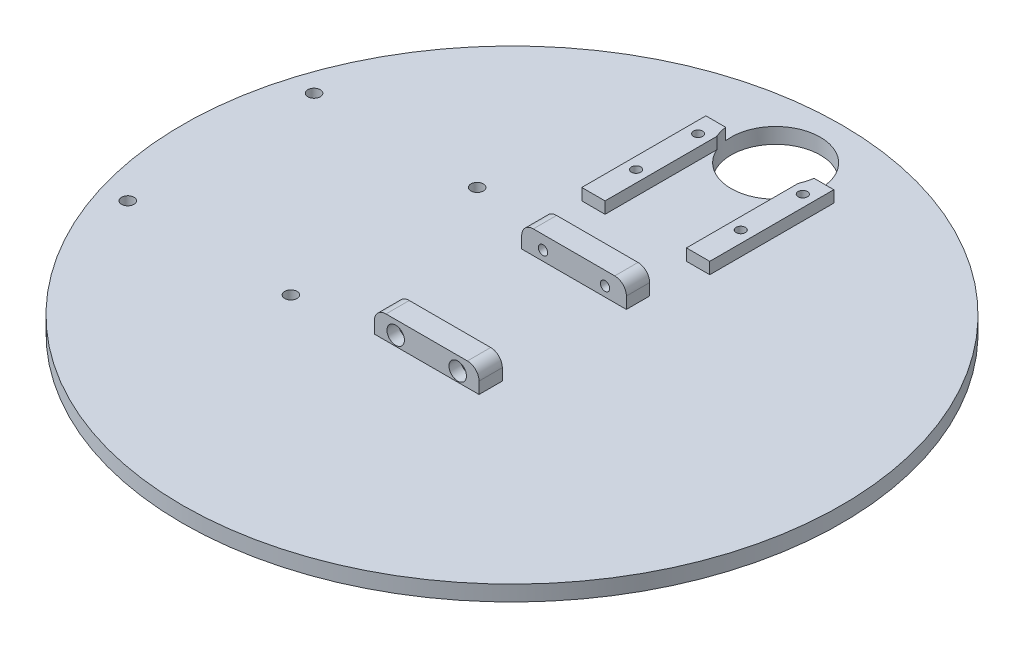
from build123d import *

# Parameters (mm, degrees)
SKETCH1_R                                           = 37.65
SKETCH1_R_2                                         = 32.65
BOSS_EXTRUDE1_DEPTH                                 = 10
BOSS_EXTRUDE2_START                                 = -4
SKETCH2_R                                           = 32.65
SKETCH2_R_2                                         = 29.65
BOSS_EXTRUDE2_DEPTH                                 = 4
SKETCH3_R                                           = 85
BOSS_EXTRUDE3_DEPTH                                 = 4
SKETCH4_W                                           = 27
SKETCH4_H                                           = 6
BOSS_EXTRUDE4_DEPTH                                 = 6
FILLET1_R                                           = 3
SKETCH6_R                                           = 2.25
CUT_EXTRUDE1_DEPTH                                  = 3
CSK_FOR_M2_COUNTERSUNK_FLAT_HEAD_SCREW1_D           = 2.4
CSK_FOR_M2_COUNTERSUNK_FLAT_HEAD_SCREW1_CSINK_D     = 4.4
CSK_FOR_M2_COUNTERSUNK_FLAT_HEAD_SCREW1_CSINK_ANGLE = 90
FILLET1_OF_MIRROR1_R                                = 3
SKETCH8_R                                           = 2.25
CUT_EXTRUDE2_DEPTH                                  = 4
SKETCH11_W                                          = 6
SKETCH11_H                                          = 16
BOSS_EXTRUDE5_DEPTH                                 = 3
CSK_FOR_M2_COUNTERSUNK_FLAT_HEAD_SCREW2_D           = 2.4
CSK_FOR_M2_COUNTERSUNK_FLAT_HEAD_SCREW2_CSINK_D     = 4.4
CSK_FOR_M2_COUNTERSUNK_FLAT_HEAD_SCREW2_CSINK_ANGLE = 90
LPATTERN1_COPY_1_SKETCH_R                           = 2.25
LPATTERN1_COPY_1_DEPTH                              = 4
LPATTERN1_COPY_2_SKETCH_W                           = 6
LPATTERN1_COPY_2_SKETCH_H                           = 16
LPATTERN1_COPY_2_DEPTH                              = 3
LPATTERN1_COPY_3_D                                  = 2.4
LPATTERN1_COPY_3_CSINK_D                            = 4.4
LPATTERN1_COPY_3_CSINK_ANGLE                        = 90
LPATTERN1_COPY_4_SKETCH_R                           = 2.25
LPATTERN1_COPY_4_DEPTH                              = 4
LPATTERN1_COPY_5_SKETCH_W                           = 6
LPATTERN1_COPY_5_SKETCH_H                           = 16
LPATTERN1_COPY_5_DEPTH                              = 3
LPATTERN1_COPY_6_D                                  = 2.4
LPATTERN1_COPY_6_CSINK_D                            = 4.4
LPATTERN1_COPY_6_CSINK_ANGLE                        = 90
CUT_EXTRUDE3_DEPTH                                  = 122.020659393
CUT_EXTRUDE3_DEPTH_BACK                             = 122.020659393
SKETCH12_R                                          = 11.5
CSK_FOR_M3_COUNTERSUNK_FLAT_HEAD_SCREW1_D           = 3.2
CSK_FOR_M3_COUNTERSUNK_FLAT_HEAD_SCREW1_CSINK_D     = 6.3
CSK_FOR_M3_COUNTERSUNK_FLAT_HEAD_SCREW1_CSINK_ANGLE = 90


with BuildPart() as part:
    # Sketch1 → Boss-Extrude1 (new body)
    with BuildSketch(Plane(origin=(0, 0, 0), x_dir=(1, 0, 0), z_dir=(0, 1, 0))):
        Circle(SKETCH1_R)
        Circle(SKETCH1_R_2, mode=Mode.SUBTRACT)
    extrude(amount=BOSS_EXTRUDE1_DEPTH)

    # Sketch2 → Boss-Extrude2 (add)
    with BuildSketch(Plane(origin=(0, 10, 0), x_dir=(1, 0, 0), z_dir=(0, 1, 0)).offset(BOSS_EXTRUDE2_START)):
        Circle(SKETCH2_R)
        Circle(SKETCH2_R_2, mode=Mode.SUBTRACT)
    extrude(amount=BOSS_EXTRUDE2_DEPTH)

    # Sketch3 → Boss-Extrude3 (add)
    with BuildSketch(Plane(origin=(0, 10, 0), x_dir=(1, 0, 0), z_dir=(0, 1, 0))):
        Circle(SKETCH3_R)
    extrude(amount=BOSS_EXTRUDE3_DEPTH)

    # Sketch4 → Boss-Extrude4 (add)
    with BuildSketch(Plane(origin=(0, 14, 0), x_dir=(1, 0, 0), z_dir=(0, 1, 0))):
        with Locations((0, 19)):
            Rectangle(SKETCH4_W, SKETCH4_H)
    boss_extrude4 = extrude(amount=BOSS_EXTRUDE4_DEPTH)

    # Fillet1
    fillet1_edges = [part.edges().sort_by_distance(p)[0] for p in [
        (-13.5, 20, -19),
        (13.5, 20, -19),
    ]]
    fillet(fillet1_edges, radius=FILLET1_R)

    # Sketch6 → Cut-Extrude1 (cut)
    with BuildSketch(Plane(origin=(0, 0, -22), x_dir=(-1, 0, 0), z_dir=(0, 0, -1))):
        with Locations((-8, 16.5)):
            Circle(SKETCH6_R)
        with Locations((8, 16.5)):
            Circle(SKETCH6_R)
    cut_extrude1 = extrude(amount=-CUT_EXTRUDE1_DEPTH, mode=Mode.SUBTRACT)

    # CSK for M2 Countersunk Flat Head Screw1 (through all)
    with Locations(Plane(origin=(8, 16.5, -19), x_dir=(-1, 0, 0), z_dir=(0, 0, -1))):
        with Locations((0, 0), (16, 0)):
            csk_for_m2_countersunk_flat_head_screw1 = CounterSinkHole(CSK_FOR_M2_COUNTERSUNK_FLAT_HEAD_SCREW1_D / 2, CSK_FOR_M2_COUNTERSUNK_FLAT_HEAD_SCREW1_CSINK_D / 2, counter_sink_angle=CSK_FOR_M2_COUNTERSUNK_FLAT_HEAD_SCREW1_CSINK_ANGLE)

    # Mirror1: Boss-Extrude4, Cut-Extrude1, CSK for M2 Countersunk Flat Head Screw1 across plane
    add(boss_extrude4.mirror(Plane.XY))
    add(cut_extrude1.mirror(Plane.XY), mode=Mode.SUBTRACT)
    add(csk_for_m2_countersunk_flat_head_screw1.mirror(Plane.XY), mode=Mode.SUBTRACT)

    # Fillet1 of Mirror1
    fillet1_of_mirror1_edges = [part.edges().sort_by_distance(p)[0] for p in [
        (-13.5, 20, 19),
        (13.5, 20, 19),
    ]]
    fillet(fillet1_of_mirror1_edges, radius=FILLET1_OF_MIRROR1_R)

    # Sketch8 → Cut-Extrude2 (cut)
    with BuildSketch(Plane(origin=(0, 10, 0), x_dir=(-1, 0, 0), z_dir=(0, -1, 0))):
        with Locations((13.5, 61.5)):
            Circle(SKETCH8_R)
    cut_extrude2 = extrude(amount=-CUT_EXTRUDE2_DEPTH, mode=Mode.SUBTRACT)

    # Sketch11 → Boss-Extrude5 (add)
    with BuildSketch(Plane(origin=(0, 14, 0), x_dir=(1, 0, 0), z_dir=(0, 1, 0))):
        with Locations((-13.5, 58.5)):
            Rectangle(SKETCH11_W, SKETCH11_H)
    boss_extrude5 = extrude(amount=BOSS_EXTRUDE5_DEPTH)

    # CSK for M2 Countersunk Flat Head Screw2 (through all)
    with Locations(Plane(origin=(-13.5, 14, -61.5), x_dir=(0, 0, -1), z_dir=(0, -1, 0))):
        with Locations((0, 0)):
            csk_for_m2_countersunk_flat_head_screw2 = CounterSinkHole(CSK_FOR_M2_COUNTERSUNK_FLAT_HEAD_SCREW2_D / 2, CSK_FOR_M2_COUNTERSUNK_FLAT_HEAD_SCREW2_CSINK_D / 2, counter_sink_angle=CSK_FOR_M2_COUNTERSUNK_FLAT_HEAD_SCREW2_CSINK_ANGLE)

    # Mirror2: Cut-Extrude2, Boss-Extrude5, CSK for M2 Countersunk Flat Head Screw2 across plane
    add(cut_extrude2.mirror(Plane(origin=(0, 0, 0), x_dir=(0, 0, 1), z_dir=(1, 0, 0))), mode=Mode.SUBTRACT)
    add(boss_extrude5.mirror(Plane(origin=(0, 0, 0), x_dir=(0, 0, 1), z_dir=(1, 0, 0))))
    add(csk_for_m2_countersunk_flat_head_screw2.mirror(Plane(origin=(0, 0, 0), x_dir=(0, 0, 1), z_dir=(1, 0, 0))), mode=Mode.SUBTRACT)

    # LPattern1 copy 1 sketch → LPattern1 copy 1 (cut)
    with BuildSketch(Plane(origin=(0, 10, 16), x_dir=(1, 0, 0), z_dir=(0, -1, 0))):
        with Locations((13.5, -61.5)):
            Circle(LPATTERN1_COPY_1_SKETCH_R)
    extrude(amount=-LPATTERN1_COPY_1_DEPTH, mode=Mode.SUBTRACT)

    # LPattern1 copy 2 sketch → LPattern1 copy 2 (add)
    with BuildSketch(Plane(origin=(0, 14, 16), x_dir=(-1, 0, 0), z_dir=(0, 1, 0))):
        with Locations((-13.5, -58.5)):
            Rectangle(LPATTERN1_COPY_2_SKETCH_W, LPATTERN1_COPY_2_SKETCH_H)
    extrude(amount=LPATTERN1_COPY_2_DEPTH)

    # LPattern1 copy 3 (through all)
    with Locations(Plane(origin=(13.5, 14, -45.5), x_dir=(0, 0, -1), z_dir=(0, -1, 0))):
        with Locations((0, 0)):
            CounterSinkHole(LPATTERN1_COPY_3_D / 2, LPATTERN1_COPY_3_CSINK_D / 2, counter_sink_angle=LPATTERN1_COPY_3_CSINK_ANGLE)

    # LPattern1 copy 4 sketch → LPattern1 copy 4 (cut)
    with BuildSketch(Plane(origin=(0, 10, 16), x_dir=(-1, 0, 0), z_dir=(0, -1, 0))):
        with Locations((13.5, 61.5)):
            Circle(LPATTERN1_COPY_4_SKETCH_R)
    extrude(amount=-LPATTERN1_COPY_4_DEPTH, mode=Mode.SUBTRACT)

    # LPattern1 copy 5 sketch → LPattern1 copy 5 (add)
    with BuildSketch(Plane(origin=(0, 14, 16), x_dir=(1, 0, 0), z_dir=(0, 1, 0))):
        with Locations((-13.5, 58.5)):
            Rectangle(LPATTERN1_COPY_5_SKETCH_W, LPATTERN1_COPY_5_SKETCH_H)
    extrude(amount=LPATTERN1_COPY_5_DEPTH)

    # LPattern1 copy 6 (through all)
    with Locations(Plane(origin=(-13.5, 14, -45.5), x_dir=(0, 0, -1), z_dir=(0, -1, 0))):
        with Locations((0, 0)):
            CounterSinkHole(LPATTERN1_COPY_6_D / 2, LPATTERN1_COPY_6_CSINK_D / 2, counter_sink_angle=LPATTERN1_COPY_6_CSINK_ANGLE)

    # Sketch12 → Cut-Extrude3 (cut, two sides: drawn at the far end of the back side and taken through both)
    with BuildSketch(Plane(origin=(0, 14, 0), x_dir=(1, 0, 0), z_dir=(0, 1, 0)).offset(-CUT_EXTRUDE3_DEPTH_BACK)):
        with Locations((0, 68)):
            Circle(SKETCH12_R)
    extrude(amount=CUT_EXTRUDE3_DEPTH + CUT_EXTRUDE3_DEPTH_BACK, mode=Mode.SUBTRACT)

    # CSK for M3 Countersunk Flat Head Screw1 (through all)
    with Locations(Plane(origin=(-33, 10, -24.02), x_dir=(0, 0, -1), z_dir=(0, -1, 0))):
        with Locations((0, 0), (0, -42.07), (-48.04, -42.07), (-48.04, 0)):
            CounterSinkHole(CSK_FOR_M3_COUNTERSUNK_FLAT_HEAD_SCREW1_D / 2, CSK_FOR_M3_COUNTERSUNK_FLAT_HEAD_SCREW1_CSINK_D / 2, counter_sink_angle=CSK_FOR_M3_COUNTERSUNK_FLAT_HEAD_SCREW1_CSINK_ANGLE)


solid = part.part
